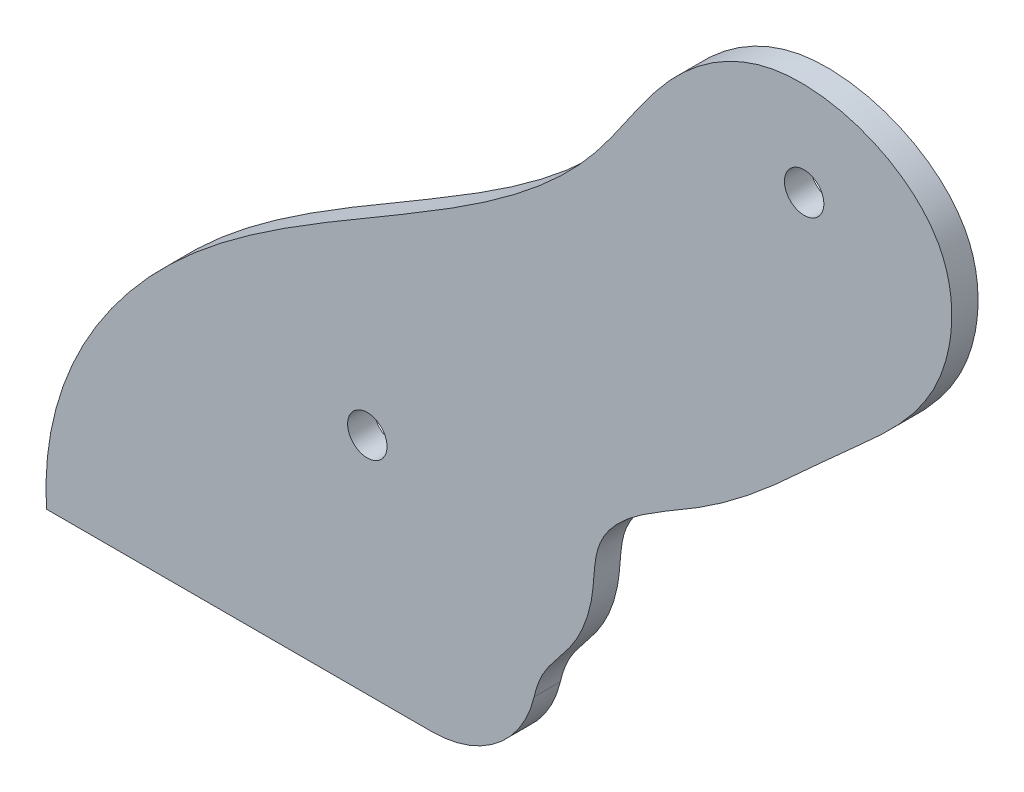
from build123d import *

# Parameters (mm, degrees)
SKETCH1_R           = 2.38125
BOSS_EXTRUDE1_DEPTH = 3.175
FILLET1_START       = -1
FILLET1_DEPTH       = 5


with BuildPart() as part:
    # Sketch1 → Boss-Extrude1 (new body)
    with BuildSketch(Plane.XY):
        with BuildLine():
            Line((417.546081306, 18.658951039), (360.644130569, 18.658951039))
            add(Edge.make_bspline(
                [(360.644130569, 18.658951039), (359.838395401, 32.32505811), (373.162837365, 53.495691257), (402.403655017, 70.061286374), (425.115341274, 83.957066052), (435.168216309, 102.155706872), (450.412839391, 112.167568554), (471.322609911, 103.87550785), (469.702927035, 83.445208809), (454.962785943, 71.561610112), (442.645833335, 58.773501793), (426.712648337, 51.662319225), (426.83700418, 41.786859869), (424.606227179, 36.070100281), (418.230705297, 29.809424472), (419.314069358, 22.139312518), (417.546081306, 18.658951039)],
                knots=[0, 0, 0, 0, 0.153616331, 0.274148567, 0.398594081, 0.457961643, 0.516431911, 0.601433325, 0.654877323, 0.725582071, 0.814973141, 0.878081726, 0.897227189, 0.926552602, 0.948638612, 1, 1, 1, 1], degree=3))
        make_face()
        with Locations((452.168961384, 97.538903913)):
            Circle(SKETCH1_R, mode=Mode.SUBTRACT)
        with Locations((399.40430293, 45.775343541)):
            Circle(SKETCH1_R, mode=Mode.SUBTRACT)
    extrude(amount=BOSS_EXTRUDE1_DEPTH)

    # Fillet1: read off the stored shape, not the designer's step
    # Fillet1 outline → Fillet1 (cut)
    with BuildSketch(Plane.XY.offset(FILLET1_START)):
        with BuildLine():
            add(Edge.make_bspline(
                [(419.550020031, 28.475414315), (418.771360058, 25.135518643), (418.907467493, 21.33889904), (417.546081306, 18.658951039)],
                knots=[0.960450703, 0.960450703, 0.960450703, 0.960450703, 1, 1, 1, 1], degree=3))
            ThreePointArc((419.550020031, 28.475414315), (415.07692775, 21.41131523), (407.18170503, 18.658951039))
            Line((407.18170503, 18.658951039), (417.546081306, 18.658951039))
        make_face()
    extrude(amount=FILLET1_DEPTH, mode=Mode.SUBTRACT)


solid = part.part
